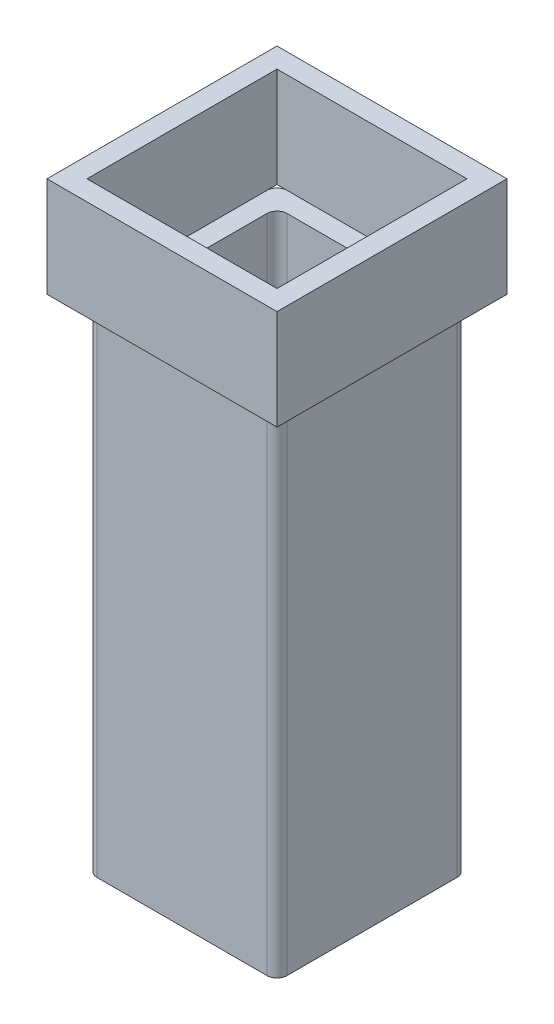
from build123d import *

# Parameters (mm, degrees)
CROQUIS1_W              = 19
CROQUIS1_H              = 19
CROQUIS1_W_2            = 15
CROQUIS1_H_2            = 15
SALIENTE_EXTRUIR1_DEPTH = 50
CROQUIS2_W              = 23
CROQUIS2_H              = 23
CROQUIS2_W_2            = 19
CROQUIS2_H_2            = 19
SALIENTE_EXTRUIR2_DEPTH = 10
REDONDEO1_R             = 1


with BuildPart() as part:
    # Croquis1 → Saliente-Extruir1 (new body)
    with BuildSketch(Plane(origin=(0, 0, 0), x_dir=(1, 0, 0), z_dir=(0, 1, 0))):
        Rectangle(CROQUIS1_W, CROQUIS1_H)
        Rectangle(CROQUIS1_W_2, CROQUIS1_H_2, mode=Mode.SUBTRACT)
    extrude(amount=SALIENTE_EXTRUIR1_DEPTH)

    # Redondeo1
    redondeo1_edges = [part.edges().sort_by_distance(p)[0] for p in [
        (-7.5, 25, 7.5),
        (-7.5, 25, -7.5),
        (7.5, 25, -7.5),
        (7.5, 25, 7.5),
        (9.5, 25, 9.5),
        (-9.5, 25, 9.5),
        (-9.5, 25, -9.5),
        (9.5, 25, -9.5),
    ]]
    fillet(redondeo1_edges, radius=REDONDEO1_R)


with BuildPart() as body_2:
    # Croquis2 → Saliente-Extruir2 (new body)
    with BuildSketch(Plane(origin=(0, 50, 0), x_dir=(1, 0, 0), z_dir=(0, 1, 0))):
        Rectangle(CROQUIS2_W, CROQUIS2_H)
        Rectangle(CROQUIS2_W_2, CROQUIS2_H_2, mode=Mode.SUBTRACT)
    extrude(amount=SALIENTE_EXTRUIR2_DEPTH)


solid = Compound([part.part, body_2.part])
